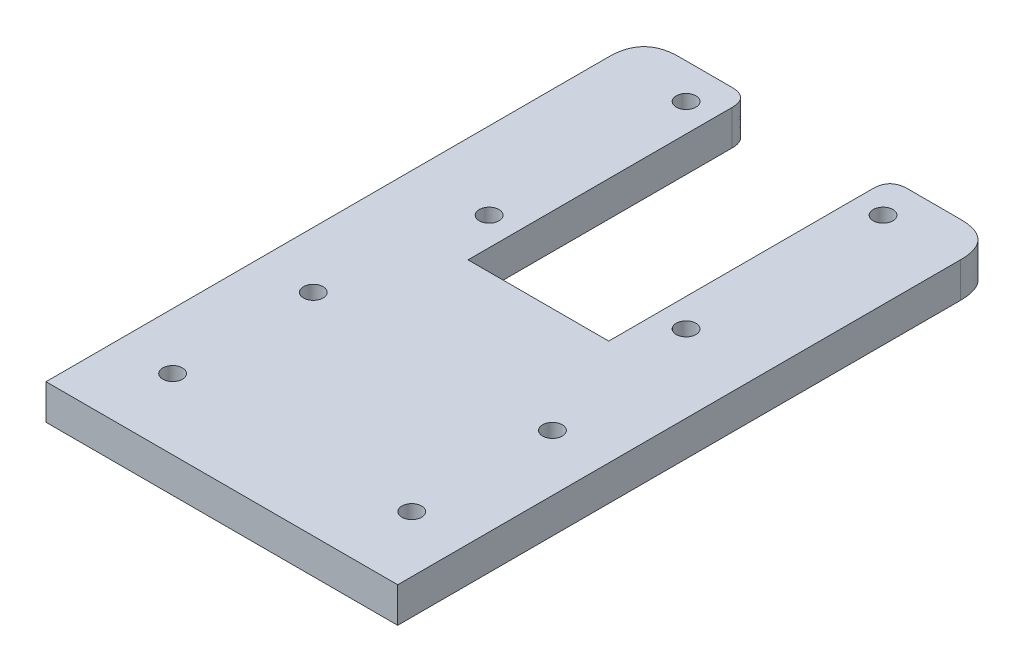
from build123d import *

# Parameters (mm, degrees)
SKETCH1_W           = 50
SKETCH1_H           = 85
BOSS_EXTRUDE1_DEPTH = 5
SKETCH2_R           = 1.4
CUT_EXTRUDE1_DEPTH  = 5
SKETCH3_W           = 20
SKETCH3_H           = 40
CUT_EXTRUDE2_DEPTH  = 5
FILLET3_SIZE        = 5
FILLET4_SIZE        = 5
FILLET5_SIZE        = 2.5
FILLET6_SIZE        = 2.5
SKETCH4_R           = 1.4
CUT_EXTRUDE3_DEPTH  = 5


with BuildPart() as part:
    # Sketch1 → Boss-Extrude1 (new body)
    with BuildSketch(Plane(origin=(0, 0, 0), x_dir=(1, 0, 0), z_dir=(0, 1, 0))):
        Rectangle(SKETCH1_W, SKETCH1_H)
    extrude(amount=BOSS_EXTRUDE1_DEPTH)

    # Sketch2 → Cut-Extrude1 (cut)
    with BuildSketch(Plane(origin=(0, 5, 0), x_dir=(1, 0, 0), z_dir=(0, 1, 0))):
        with Locations(Location((-14, 37.5, 0), (0, 0, 270))):
            Circle(SKETCH2_R)
        with Locations(Location((14, 37.5, 0), (0, 0, 90))):
            Circle(SKETCH2_R)
        with Locations(Location((-14, 9.5, 0), (0, 0, 270))):
            Circle(SKETCH2_R)
        with Locations(Location((14, 9.5, 0), (0, 0, 90))):
            Circle(SKETCH2_R)
    extrude(amount=-CUT_EXTRUDE1_DEPTH, mode=Mode.SUBTRACT)

    # Sketch3 → Cut-Extrude2 (cut)
    with BuildSketch(Plane(origin=(0, 5, 0), x_dir=(1, 0, 0), z_dir=(0, 1, 0))):
        with Locations((0, 22.5)):
            Rectangle(SKETCH3_W, SKETCH3_H)
    extrude(amount=-CUT_EXTRUDE2_DEPTH, mode=Mode.SUBTRACT)

    # Fillet3
    # a fillet whose section is not a circle: 5 mm, written as the material it takes off along each edge
    with BuildSketch(Plane(origin=(-25, -12.5, -42.5), x_dir=(0, 0, 1), z_dir=(0, 1, 0))) as fillet3_piece_1:
        with BuildLine():
            Bezier((FILLET3_SIZE, 0), (0, 0), (0, FILLET3_SIZE), weights=[1, 1, 1])
            Line((0, FILLET3_SIZE), (0, 0))
            Line((0, 0), (FILLET3_SIZE, 0))
        make_face()
    extrude(amount=30, mode=Mode.SUBTRACT)

    # Fillet4
    # a fillet whose section is not a circle: 5 mm, written as the material it takes off along each edge
    with BuildSketch(Plane(origin=(25, -12.5, -42.5), x_dir=(0, 0, 1), z_dir=(0, 1, 0))) as fillet4_piece_1:
        with BuildLine():
            Bezier((FILLET4_SIZE, 0), (0, 0), (0, -FILLET4_SIZE), weights=[1, 1, 1])
            Line((0, -FILLET4_SIZE), (0, 0))
            Line((0, 0), (FILLET4_SIZE, 0))
        make_face()
    extrude(amount=30, mode=Mode.SUBTRACT)

    # Fillet5
    # a fillet whose section is not a circle: 2.5 mm, written as the material it takes off along each edge
    with BuildSketch(Plane(origin=(-10, 11.25, -42.5), x_dir=(0, 0, 1), z_dir=(0, -1, 0))) as fillet5_piece_1:
        with BuildLine():
            Bezier((FILLET5_SIZE, 0), (0, 0), (0, FILLET5_SIZE), weights=[1, 1, 1])
            Line((0, FILLET5_SIZE), (0, 0))
            Line((0, 0), (FILLET5_SIZE, 0))
        make_face()
    extrude(amount=17.5, mode=Mode.SUBTRACT)

    # Fillet6
    # a fillet whose section is not a circle: 2.5 mm, written as the material it takes off along each edge
    with BuildSketch(Plane(origin=(10, 11.25, -42.5), x_dir=(0, 0, 1), z_dir=(0, -1, 0))) as fillet6_piece_1:
        with BuildLine():
            Bezier((FILLET6_SIZE, 0), (0, 0), (0, -FILLET6_SIZE), weights=[1, 1, 1])
            Line((0, -FILLET6_SIZE), (0, 0))
            Line((0, 0), (FILLET6_SIZE, 0))
        make_face()
    extrude(amount=17.5, mode=Mode.SUBTRACT)

    # Sketch4 → Cut-Extrude3 (cut)
    with BuildSketch(Plane(origin=(0, 5, 0), x_dir=(1, 0, 0), z_dir=(0, 1, 0))):
        with Locations(Location((-17, -32.5, 0), (0, 0, 270))):
            Circle(SKETCH4_R)
        with Locations(Location((17, -32.5, 0), (0, 0, 90))):
            Circle(SKETCH4_R)
        with Locations(Location((17, -12.5, 0), (0, 0, 270))):
            Circle(SKETCH4_R)
        with Locations(Location((-17, -12.5, 0), (0, 0, 90))):
            Circle(SKETCH4_R)
    extrude(amount=-CUT_EXTRUDE3_DEPTH, mode=Mode.SUBTRACT)


solid = part.part
